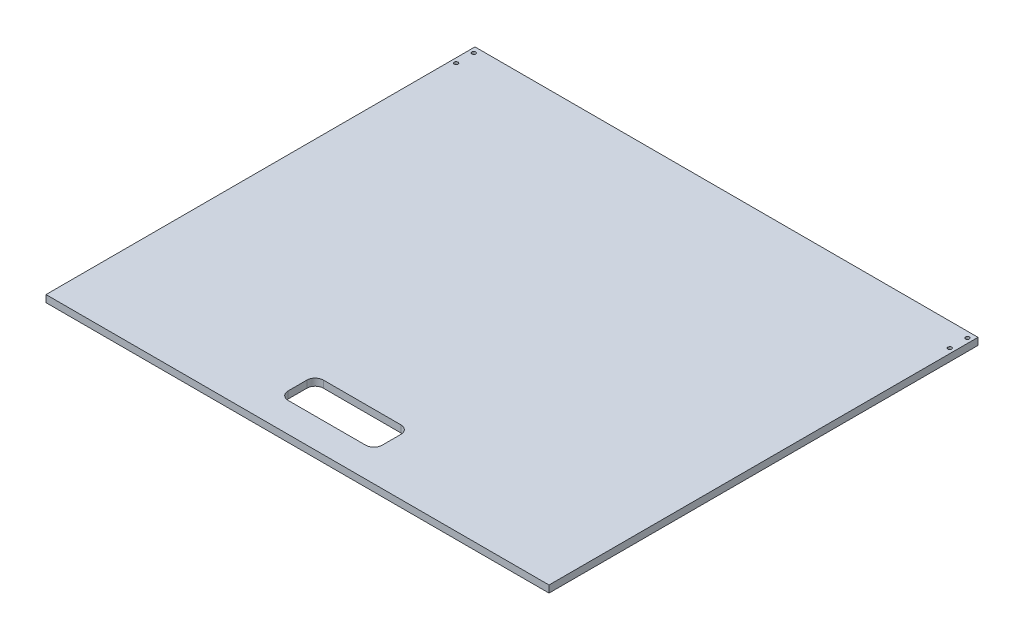
from build123d import *

# Parameters (mm, degrees)
SKETCH1_W           = 428
SKETCH1_H           = 365
BOSS_EXTRUDE1_DEPTH = 6
SKETCH2_R           = 1.6
CUT_EXTRUDE1_DEPTH  = 282.315214661
CUT_EXTRUDE2_DEPTH  = 282.315214661


with BuildPart() as part:
    # Sketch1 → Boss-Extrude1 (new body)
    with BuildSketch(Plane(origin=(0, 0, 0), x_dir=(1, 0, 0), z_dir=(0, 1, 0))):
        Rectangle(SKETCH1_W, SKETCH1_H)
    extrude(amount=BOSS_EXTRUDE1_DEPTH)

    # Sketch2 → Cut-Extrude1 (cut, through all)
    with BuildSketch(Plane.XZ):
        with Locations((210, -162.5)):
            Circle(SKETCH2_R)
        with Locations((210, -177.5)):
            Circle(SKETCH2_R)
    cut_extrude1 = extrude(amount=-CUT_EXTRUDE1_DEPTH, mode=Mode.SUBTRACT)

    # Mirror1: Cut-Extrude1 across plane
    add(cut_extrude1.mirror(Plane(origin=(0, 0, 0), x_dir=(0, 0, 1), z_dir=(1, 0, 0))), mode=Mode.SUBTRACT)

    # Sketch3 → Cut-Extrude2 (cut, through all)
    with BuildSketch(Plane(origin=(0, 6, 0), x_dir=(1, 0, 0), z_dir=(0, 1, 0))):
        with BuildLine():
            Line((-33, -157.5), (33, -157.5))
            ThreePointArc((33, -157.5), (37.949747468, -155.449747468), (40, -150.5))
            Line((40, -150.5), (40, -134.5))
            ThreePointArc((40, -134.5), (37.949747468, -129.550252532), (33, -127.5))
            Line((33, -127.5), (-33, -127.5))
            ThreePointArc((-33, -127.5), (-37.949747468, -129.550252532), (-40, -134.5))
            Line((-40, -134.5), (-40, -150.5))
            ThreePointArc((-40, -150.5), (-37.949747468, -155.449747468), (-33, -157.5))
        make_face()
    extrude(amount=-CUT_EXTRUDE2_DEPTH, mode=Mode.SUBTRACT)


solid = part.part
